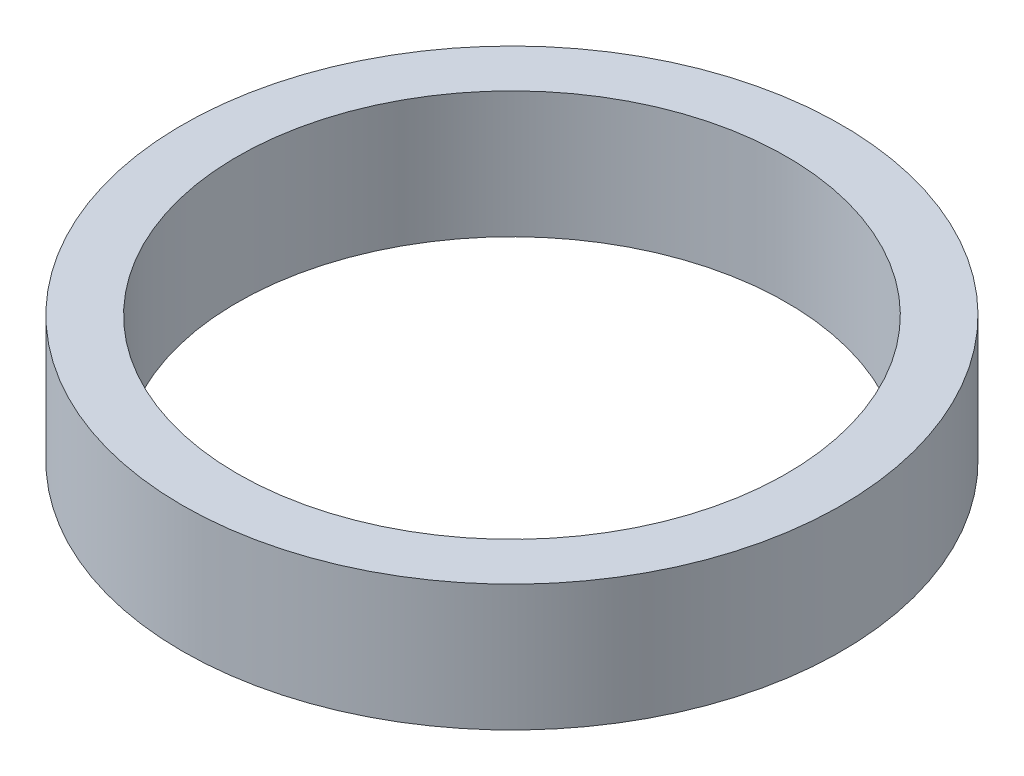
from build123d import *

# Parameters (mm, degrees)
SKETCH1_R           = 60
BOSS_EXTRUDE1_DEPTH = 23
SKETCH2_R           = 50
CUT_EXTRUDE1_DEPTH  = 88.914731416


with BuildPart() as part:
    # Sketch1 → Boss-Extrude1 (new body)
    with BuildSketch(Plane(origin=(0, 0, 0), x_dir=(1, 0, 0), z_dir=(0, 1, 0))):
        Circle(SKETCH1_R)
    extrude(amount=BOSS_EXTRUDE1_DEPTH)

    # Sketch2 → Cut-Extrude1 (cut, through all)
    with BuildSketch(Plane(origin=(0, 0, 0), x_dir=(1, 0, 0), z_dir=(0, 1, 0))):
        Circle(SKETCH2_R)
    extrude(amount=CUT_EXTRUDE1_DEPTH, mode=Mode.SUBTRACT)


solid = part.part
